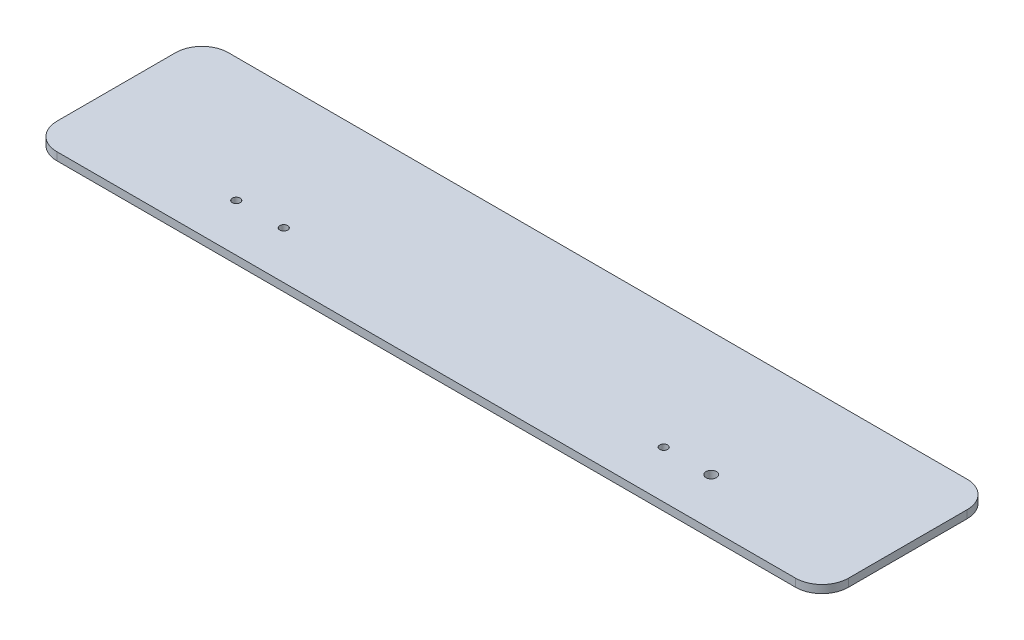
from build123d import *

# Parameters (mm, degrees)
SKETCH_1_W          = 300
SKETCH_1_H          = 65
EXTRUDE_1_DEPTH     = 3
FILLET_1_R          = 10
SKETCH_2_R          = 1.5
SKETCH_2_R_2        = 2
CUT_EXTRUDE_1_DEPTH = 307.97556906


with BuildPart() as part:
    # 草图1 → 凸台-拉伸1 (new body)
    with BuildSketch(Plane(origin=(0, 0, 0), x_dir=(1, 0, 0), z_dir=(0, 1, 0))):
        with Locations((150, 32.5)):
            Rectangle(SKETCH_1_W, SKETCH_1_H)
    extrude(amount=EXTRUDE_1_DEPTH)

    # 圆角1
    fillet_1_edges = [part.edges().sort_by_distance(p)[0] for p in [
        (0, 1.5, 0),
        (0, 1.5, -65),
        (300, 1.5, 0),
        (300, 1.5, -65),
    ]]
    fillet(fillet_1_edges, radius=FILLET_1_R)

    # 草图2 → 切除-拉伸1 (cut, through all)
    with BuildSketch(Plane(origin=(0, 3, 0), x_dir=(1, 0, 0), z_dir=(0, 1, 0))):
        with Locations((60, 18)):
            Circle(SKETCH_2_R)
        with Locations((240, 18)):
            Circle(SKETCH_2_R_2)
        with Locations((78, 18)):
            Circle(SKETCH_2_R)
        with Locations((222, 18)):
            Circle(SKETCH_2_R)
    extrude(amount=-CUT_EXTRUDE_1_DEPTH, mode=Mode.SUBTRACT)


solid = part.part
